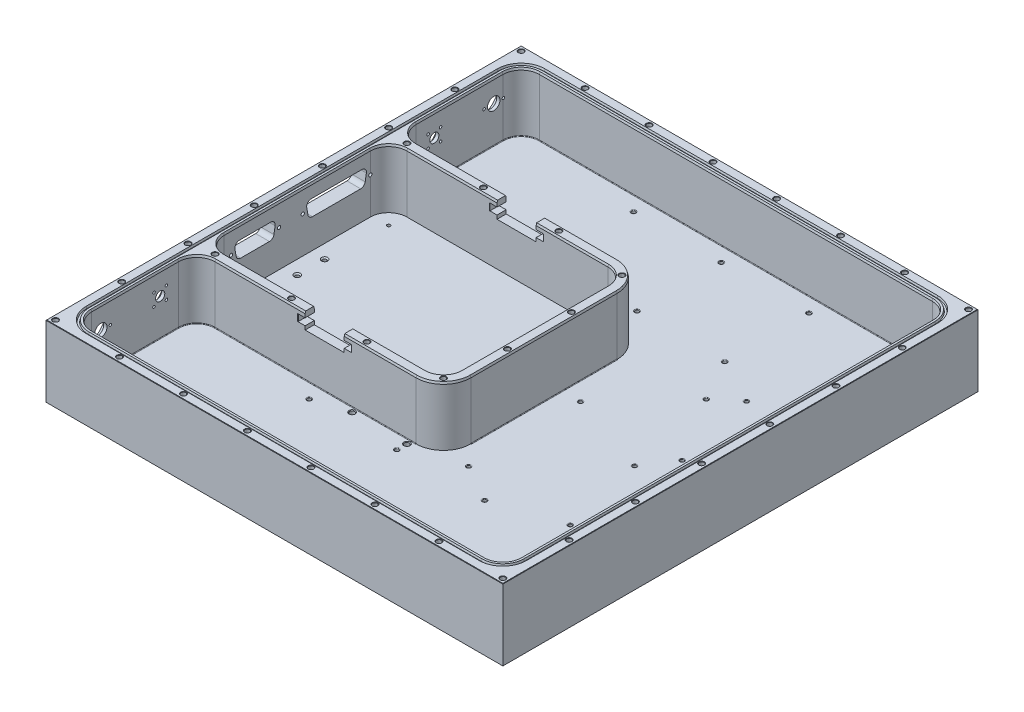
from build123d import *

# Parameters (mm, degrees)
SKETCH3_W                           = 317.5
SKETCH3_H                           = 330.2
EXTRUDE1_DEPTH                      = 8.255
SKETCH4_W                           = 317.5
SKETCH4_H                           = 330.2
EXTRUDE2_DEPTH                      = 41.275
SKETCH6_R                           = 1.7145
F_6_32_HOLES_DEPTH                  = 9.525
SKETCH16_R                          = 12.7
SMA_SMF_POCKETS_DEPTH               = 455.969838282
SKETCH17_R                          = 0.889
SKETCH17_R_2                        = 3.175
SKETCH17_R_3                        = 4.3053
MOUNT_HOLES_DEPTH                   = 12.7
SKETCH19_W                          = 27.178
SKETCH19_H                          = 175.175904301
DE9_DEPTH                           = 11.303
SKETCH18_R                          = 1.1303
DA15_DB25_DEPTH                     = 12.7
SKETCH50_R                          = 1.26365
F_4_40_OUTER_POCKET_DEPTH           = 460.936860485
SKETCH21_R                          = 1.35255
F_6_32_INSIDE_DEPTH                 = 460.936860485
FILLET1_R                           = 0.381
CUT_EXTRUDE1_REACH                  = 399.129
SKETCH31_W                          = 37.084
SKETCH31_H                          = 4.7752
FILLET2_R                           = 0.254
RADIUS_CORNERS_DEPTH                = 460.936860485
SKETCH37_R                          = 1.7145
CUT_EXTRUDE3_DEPTH                  = 9.525
SKETCH38_R                          = 1.19126
CUT_EXTRUDE5_DEPTH                  = 25.4
CHAMFER1_SIZE                       = 0.254
GROOVE_DEPTH                        = 441.184449404
GROOVE_DRAFT                        = 15
CUT_EXTRUDE7_DEPTH                  = 441.19423235
CUT_EXTRUDE7_DRAFT                  = 15
CUT_EXTRUDE7_PROFILE_2_DEPTH        = 441.19423235
CUT_EXTRUDE7_PROFILE_2_DRAFT        = 15
F_4_40_HOLE_PATTERN_INSIDE_POCKET_R = 1.1303
CUT_EXTRUDE8_DEPTH                  = 460.936860485


# Read off the part's stored shape, not the designer's step: #6-32 Tapped Hole2, #6-32 Tapped Hole3, #6-32 Tapped Hole1
with BuildPart() as part:
    # Sketch3 → Extrude1 (new body)
    with BuildSketch(Plane(origin=(0, 0, 0), x_dir=(1, 0, 0), z_dir=(0, 1, 0))):
        with Locations((158.75, 165.1)):
            Rectangle(SKETCH3_W, SKETCH3_H)
    extrude(amount=-EXTRUDE1_DEPTH)

    # Sketch4 → Extrude2 (add)
    with BuildSketch(Plane(origin=(0, 0, 0), x_dir=(1, 0, 0), z_dir=(0, 1, 0))):
        with Locations((158.75, 165.1)):
            Rectangle(SKETCH4_W, SKETCH4_H)
        with BuildLine():
            Line((9.525, 114.3), (9.525, 215.9))
            ThreePointArc((9.525, 215.9), (13.244743879, 224.880256121), (22.225, 228.6))
            Line((22.225, 228.6), (161.925, 228.6))
            ThreePointArc((161.925, 228.6), (170.905256121, 224.880256121), (174.625, 215.9))
            Line((174.625, 215.9), (174.625, 114.3))
            ThreePointArc((174.625, 114.3), (170.905256121, 105.319743879), (161.925, 101.6))
            Line((161.925, 101.6), (22.225, 101.6))
            ThreePointArc((22.225, 101.6), (13.244743879, 105.319743879), (9.525, 114.3))
        make_face(mode=Mode.SUBTRACT)
        with BuildLine():
            Line((22.225, 234.95), (180.975, 234.95))
            Line((180.975, 234.95), (180.975, 95.25))
            Line((180.975, 95.25), (22.225, 95.25))
            ThreePointArc((22.225, 95.25), (13.244743879, 91.530256121), (9.525, 82.55))
            Line((9.525, 82.55), (9.525, 22.225))
            ThreePointArc((9.525, 22.225), (13.244743879, 13.244743879), (22.225, 9.525))
            Line((22.225, 9.525), (295.275, 9.525))
            ThreePointArc((295.275, 9.525), (304.255256121, 13.244743879), (307.975, 22.225))
            Line((307.975, 22.225), (307.975, 307.975))
            ThreePointArc((307.975, 307.975), (304.255256121, 316.955256121), (295.275, 320.675))
            Line((295.275, 320.675), (22.225, 320.675))
            ThreePointArc((22.225, 320.675), (13.244743879, 316.955256121), (9.525, 307.975))
            Line((9.525, 307.975), (9.525, 247.65))
            ThreePointArc((9.525, 247.65), (13.244743879, 238.669743879), (22.225, 234.95))
        make_face(mode=Mode.SUBTRACT)
    extrude(amount=EXTRUDE2_DEPTH)

    # Sketch6 → 6-32 holes (cut)
    with BuildSketch(Plane(origin=(0, 41.275, 0), x_dir=(-1, 0, 0), z_dir=(0, 1, 0))):
        with Locations(Location((-3.302, -326.898, 0), (0, 0, 90))):
            Circle(SKETCH6_R)
        with Locations(Location((-3.302, -280.8605, 0), (0, 0, 90))):
            Circle(SKETCH6_R)
        with Locations(Location((-3.302, -234.823, 0), (0, 0, 90))):
            Circle(SKETCH6_R)
        with Locations(Location((-3.302, -188.7855, 0), (0, 0, 90))):
            Circle(SKETCH6_R)
        with Locations(Location((-3.302, -3.302, 0), (0, 0, 90))):
            Circle(SKETCH6_R)
        with Locations(Location((-3.302, -49.3395, 0), (0, 0, 90))):
            Circle(SKETCH6_R)
        with Locations(Location((-3.302, -95.377, 0), (0, 0, 90))):
            Circle(SKETCH6_R)
        with Locations(Location((-3.302, -141.4145, 0), (0, 0, 90))):
            Circle(SKETCH6_R)
        with Locations(Location((-47.752, -326.898, 0), (0, 0, 90))):
            Circle(SKETCH6_R)
        with Locations(Location((-92.202, -326.898, 0), (0, 0, 90))):
            Circle(SKETCH6_R)
        with Locations(Location((-136.652, -326.898, 0), (0, 0, 90))):
            Circle(SKETCH6_R)
        with Locations(Location((-314.198, -326.898, 0), (0, 0, 90))):
            Circle(SKETCH6_R)
        with Locations(Location((-269.748, -326.898, 0), (0, 0, 90))):
            Circle(SKETCH6_R)
        with Locations(Location((-225.298, -326.898, 0), (0, 0, 90))):
            Circle(SKETCH6_R)
        with Locations(Location((-180.848, -326.898, 0), (0, 0, 90))):
            Circle(SKETCH6_R)
        with Locations(Location((-314.198, -280.8605, 0), (0, 0, 90))):
            Circle(SKETCH6_R)
        with Locations(Location((-314.198, -234.823, 0), (0, 0, 90))):
            Circle(SKETCH6_R)
        with Locations(Location((-314.198, -188.7855, 0), (0, 0, 90))):
            Circle(SKETCH6_R)
        with Locations(Location((-47.752, -3.302, 0), (0, 0, 90))):
            Circle(SKETCH6_R)
        with Locations(Location((-92.202, -3.302, 0), (0, 0, 90))):
            Circle(SKETCH6_R)
        with Locations(Location((-136.652, -3.302, 0), (0, 0, 90))):
            Circle(SKETCH6_R)
        with Locations(Location((-314.198, -3.302, 0), (0, 0, 90))):
            Circle(SKETCH6_R)
        with Locations(Location((-269.748, -3.302, 0), (0, 0, 90))):
            Circle(SKETCH6_R)
        with Locations(Location((-225.298, -3.302, 0), (0, 0, 90))):
            Circle(SKETCH6_R)
        with Locations(Location((-180.848, -3.302, 0), (0, 0, 90))):
            Circle(SKETCH6_R)
        with Locations(Location((-314.198, -49.3395, 0), (0, 0, 90))):
            Circle(SKETCH6_R)
        with Locations(Location((-314.198, -95.377, 0), (0, 0, 90))):
            Circle(SKETCH6_R)
        with Locations(Location((-314.198, -141.4145, 0), (0, 0, 90))):
            Circle(SKETCH6_R)
        with Locations(Location((-19.05, -231.775, 0), (0, 0, 90))):
            Circle(SKETCH6_R)
        with Locations(Location((-72.2122, -231.775, 0), (0, 0, 90))):
            Circle(SKETCH6_R)
        with Locations(Location((-124.6378, -231.775, 0), (0, 0, 90))):
            Circle(SKETCH6_R)
        with Locations(Location((-177.8, -231.775, 0), (0, 0, 90))):
            Circle(SKETCH6_R)
        with Locations(Location((-177.8, -187.325, 0), (0, 0, 90))):
            Circle(SKETCH6_R)
        with Locations(Location((-177.8, -142.875, 0), (0, 0, 90))):
            Circle(SKETCH6_R)
        with Locations(Location((-177.8, -98.425, 0), (0, 0, 90))):
            Circle(SKETCH6_R)
        with Locations(Location((-124.6378, -98.425, 0), (0, 0, 90))):
            Circle(SKETCH6_R)
        with Locations(Location((-72.2122, -98.425, 0), (0, 0, 90))):
            Circle(SKETCH6_R)
        with Locations(Location((-19.05, -98.425, 0), (0, 0, 90))):
            Circle(SKETCH6_R)
    extrude(amount=-F_6_32_HOLES_DEPTH, mode=Mode.SUBTRACT)

    # Sketch16 → SMA & SMF pockets (cut, through all)
    with BuildSketch(Plane.ZY.offset(-7.239)):
        with Locations(Location((-69.85, 25.4, 0), (0, 0, 180))):
            Circle(SKETCH16_R)
        with Locations(Location((-260.35, 25.4, 0), (0, 0, 180))):
            Circle(SKETCH16_R)
        with Locations(Location((-301.625, 25.4, 0), (0, 0, 180))):
            Circle(SKETCH16_R)
        with Locations(Location((-28.575, 25.4, 0), (0, 0, 180))):
            Circle(SKETCH16_R)
    extrude(amount=SMA_SMF_POCKETS_DEPTH, mode=Mode.SUBTRACT)

    # Sketch17 → mount holes (cut)
    with BuildSketch(Plane.ZY):
        with Locations((-256.032, 21.082)):
            Circle(SKETCH17_R)
        with Locations((-256.032, 29.718)):
            Circle(SKETCH17_R)
        with Locations((-260.35, 25.4)):
            Circle(SKETCH17_R_2)
        with Locations((-264.668, 21.082)):
            Circle(SKETCH17_R)
        with Locations((-264.668, 29.718)):
            Circle(SKETCH17_R)
        with Locations((-65.532, 21.082)):
            Circle(SKETCH17_R)
        with Locations((-65.532, 29.718)):
            Circle(SKETCH17_R)
        with Locations((-74.168, 29.718)):
            Circle(SKETCH17_R)
        with Locations((-74.168, 21.082)):
            Circle(SKETCH17_R)
        with Locations((-69.85, 25.4)):
            Circle(SKETCH17_R_2)
        with Locations((-294.925, 25.4)):
            Circle(SKETCH17_R)
        with Locations((-308.325, 25.4)):
            Circle(SKETCH17_R)
        with Locations((-301.625, 25.4)):
            Circle(SKETCH17_R_3)
        with Locations((-21.875, 25.4)):
            Circle(SKETCH17_R)
        with Locations((-28.575, 25.4)):
            Circle(SKETCH17_R_3)
        with Locations((-35.275, 25.4)):
            Circle(SKETCH17_R)
    extrude(amount=-MOUNT_HOLES_DEPTH, mode=Mode.SUBTRACT)

    # Sketch19 → DE9 (cut)
    with BuildSketch(Plane(origin=(0, 41.275, 0), x_dir=(-1, 0, 0), z_dir=(0, 1, 0))):
        with Locations((-98.425, -153.785049907)):
            Rectangle(SKETCH19_W, SKETCH19_H)
    extrude(amount=-DE9_DEPTH, mode=Mode.SUBTRACT)

    # Sketch18 → DA15 & DB25 (cut)
    with BuildSketch(Plane(origin=(0, 0, 0), x_dir=(0, 0, -1), z_dir=(1, 0, 0))):
        with Locations(Location((215.9, 25.4, 0), (0, 0, 90))):
            Circle(SKETCH18_R)
        with Locations((168.91, 25.4)):
            Circle(SKETCH18_R)
        with Locations((152.4, 25.4)):
            Circle(SKETCH18_R)
        with Locations((119.1006, 25.4)):
            Circle(SKETCH18_R)
        with BuildLine():
            Line((175.653754009, 20.363332964), (209.156245991, 20.363332964))
            ThreePointArc((209.156245991, 20.363332964), (211.197096652, 21.106141857), (212.283010607, 22.987))
            Line((212.283010607, 22.987), (213.133964616, 27.813))
            ThreePointArc((213.133964616, 27.813), (212.439391107, 30.405183625), (210.0072, 31.539332964))
            Line((210.0072, 31.539332964), (174.8028, 31.539332964))
            ThreePointArc((174.8028, 31.539332964), (172.370608893, 30.405183625), (171.676035384, 27.813))
            Line((171.676035384, 27.813), (172.526989393, 22.987))
            ThreePointArc((172.526989393, 22.987), (173.612903348, 21.106141857), (175.653754009, 20.363332964))
        make_face()
        with BuildLine():
            Line((149.710164616, 27.813), (148.859210607, 22.987))
            ThreePointArc((148.859210607, 22.987), (147.773296652, 21.106141857), (145.732445991, 20.363332964))
            Line((145.732445991, 20.363332964), (125.768154009, 20.363332964))
            ThreePointArc((125.768154009, 20.363332964), (123.727303348, 21.106141857), (122.641389393, 22.987))
            Line((122.641389393, 22.987), (121.790435384, 27.813))
            ThreePointArc((121.790435384, 27.813), (122.485008893, 30.405183625), (124.9172, 31.539332964))
            Line((124.9172, 31.539332964), (146.5834, 31.539332964))
            ThreePointArc((146.5834, 31.539332964), (149.015591107, 30.405183625), (149.710164616, 27.813))
        make_face()
    extrude(amount=DA15_DB25_DEPTH, mode=Mode.SUBTRACT)

    # Sketch50 → 4-40 outer pocket (cut, through all)
    with BuildSketch(Plane(origin=(0, 0, 0), x_dir=(-1, 0, 0), z_dir=(0, 1, 0))):
        with Locations(Location((-235.839, -223.012, 0), (0, 0, 90))):
            Circle(SKETCH50_R)
        with Locations(Location((-251.079, -235.712, 0), (0, 0, 90))):
            Circle(SKETCH50_R)
        with Locations(Location((-193.675, -177.8, 0), (0, 0, 90))):
            Circle(SKETCH50_R)
        with Locations(Location((-264.287, -177.8, 0), (0, 0, 90))):
            Circle(SKETCH50_R)
        with Locations(Location((-251.079, -157.9245, 0), (0, 0, 90))):
            Circle(SKETCH50_R)
        with Locations(Location((-264.287, -100.0125, 0), (0, 0, 90))):
            Circle(SKETCH50_R)
        with Locations(Location((-193.675, -100.0125, 0), (0, 0, 90))):
            Circle(SKETCH50_R)
    extrude(amount=-F_4_40_OUTER_POCKET_DEPTH, mode=Mode.SUBTRACT)

    # Sketch21 → 6-32 inside (cut, through all)
    with BuildSketch(Plane(origin=(0, 0, 0), x_dir=(-1, 0, 0), z_dir=(0, 1, 0))):
        with Locations(Location((-97.79, -85.09, 0), (0, 0, 90))):
            Circle(SKETCH21_R)
        with Locations(Location((-158.75, -85.09, 0), (0, 0, 90))):
            Circle(SKETCH21_R)
        with Locations(Location((-219.71, -85.09, 0), (0, 0, 90))):
            Circle(SKETCH21_R)
        with Locations(Location((-97.79, -310.515, 0), (0, 0, 90))):
            Circle(SKETCH21_R)
        with Locations(Location((-97.79, -26.5176, 0), (0, 0, 90))):
            Circle(SKETCH21_R)
        with Locations(Location((-158.75, -26.5176, 0), (0, 0, 90))):
            Circle(SKETCH21_R)
        with Locations(Location((-219.71, -26.5176, 0), (0, 0, 90))):
            Circle(SKETCH21_R)
        with Locations(Location((-158.75, -310.515, 0), (0, 0, 90))):
            Circle(SKETCH21_R)
        with Locations(Location((-219.71, -310.515, 0), (0, 0, 90))):
            Circle(SKETCH21_R)
        with Locations(Location((-97.79, -251.9426, 0), (0, 0, 90))):
            Circle(SKETCH21_R)
        with Locations(Location((-158.75, -251.9426, 0), (0, 0, 90))):
            Circle(SKETCH21_R)
        with Locations(Location((-219.71, -251.9426, 0), (0, 0, 90))):
            Circle(SKETCH21_R)
    extrude(amount=-F_6_32_INSIDE_DEPTH, mode=Mode.SUBTRACT)

    # Fillet1
    fillet1_edges = [part.edges().sort_by_distance(p)[0] for p in [
        (13.244743879, 0, -238.669743879),
        (101.6, 0, -234.95),
        (180.975, 0, -165.1),
        (101.6, 0, -95.25),
        (13.244743879, 0, -91.530256121),
        (9.525, 0, -52.3875),
        (13.244743879, 0, -13.244743879),
        (158.75, 0, -9.525),
        (304.255256121, 0, -13.244743879),
        (307.975, 0, -165.1),
        (304.255256121, 0, -316.955256121),
        (158.75, 0, -320.675),
        (13.244743879, 0, -316.955256121),
        (9.525, 0, -277.8125),
        (235.839, 0, -224.27565),
        (251.079, 0, -236.97565),
        (193.675, 0, -179.06365),
        (264.287, 0, -179.06365),
        (251.079, 0, -159.18815),
        (264.287, 0, -101.27615),
        (193.675, 0, -101.27615),
        (97.79, 0, -86.44255),
        (158.75, 0, -86.44255),
        (219.71, 0, -86.44255),
        (97.79, 0, -311.86755),
        (97.79, 0, -27.87015),
        (158.75, 0, -27.87015),
        (219.71, 0, -27.87015),
        (158.75, 0, -311.86755),
        (219.71, 0, -311.86755),
        (97.79, 0, -253.29515),
        (158.75, 0, -253.29515),
        (219.71, 0, -253.29515),
    ]]
    fillet(fillet1_edges, radius=FILLET1_R)

    # Cut-Extrude1: up to this face of the body (flat: up to its plane)
    cut_extrude1_end = Plane(part.part.faces().sort_by_distance((101.757700924, 20.093113696, -234.95))[0])
    # Sketch31 → Cut-Extrude1 (cut, up to the picked face)
    with BuildSketch(Plane.XY.offset(-95.25), mode=Mode.PRIVATE) as cut_extrude1_sk1:
        with Locations((98.425, 34.925)):
            Rectangle(SKETCH31_W, SKETCH31_H)
    cut_extrude1_tool1 = split(extrude(cut_extrude1_sk1.sketch, amount=-CUT_EXTRUDE1_REACH, mode=Mode.PRIVATE), bisect_by=cut_extrude1_end, keep=Keep.BOTH, mode=Mode.PRIVATE)
    add(cut_extrude1_tool1.solids().sort_by(Axis((98.425, 34.925, -95.25), (0, 0, -1)))[0], mode=Mode.SUBTRACT)

    # Fillet2
    fillet2_edges = [part.edges().sort_by_distance(p)[0] for p in [
        (116.967, 34.925, -101.6),
        (116.967, 34.925, -228.6),
        (79.883, 34.925, -101.6),
        (79.883, 34.925, -228.6),
        (116.967, 34.925, -95.25),
        (79.883, 34.925, -95.25),
        (116.967, 34.925, -234.95),
        (79.883, 34.925, -234.95),
    ]]
    fillet(fillet2_edges, radius=FILLET2_R)

    # Sketch36 → radius corners (cut, through all)
    with BuildSketch(Plane(origin=(0, 0, 0), x_dir=(-1, 0, 0), z_dir=(0, 1, 0))):
        with BuildLine():
            Line((-180.975, -114.3), (-193.675, -114.3))
            Line((-193.675, -114.3), (-193.675, -215.9))
            Line((-193.675, -215.9), (-180.975, -215.9))
            ThreePointArc((-180.975, -215.9), (-175.395384182, -229.370384182), (-161.925, -234.95))
            Line((-161.925, -234.95), (-161.925, -253.55747471))
            Line((-161.925, -253.55747471), (-206.375, -253.55747471))
            Line((-206.375, -253.55747471), (-206.375, -76.64252529))
            Line((-206.375, -76.64252529), (-161.925, -76.64252529))
            Line((-161.925, -76.64252529), (-161.925, -95.25))
            ThreePointArc((-161.925, -95.25), (-175.395384182, -100.829615818), (-180.975, -114.3))
        make_face()
    extrude(amount=RADIUS_CORNERS_DEPTH, mode=Mode.SUBTRACT)

    # Sketch37 → Cut-Extrude3 (cut)
    with BuildSketch(Plane(origin=(0, 41.275, 0), x_dir=(-1, 0, 0), z_dir=(0, 1, 0))):
        with Locations(Location((-173.150320151, -227.125320151, 0), (0, 0, 90))):
            Circle(SKETCH37_R)
        with Locations(Location((-173.150320151, -103.074679849, 0), (0, 0, 90))):
            Circle(SKETCH37_R)
    extrude(amount=-CUT_EXTRUDE3_DEPTH, mode=Mode.SUBTRACT)

    # Sketch38 → Cut-Extrude5 (cut)
    with BuildSketch(Plane(origin=(0, 0, 0), x_dir=(0, 0, -1), z_dir=(1, 0, 0))):
        with Locations(Location((105.96626, 33.3248, 0), (0, 0, 180))):
            Circle(SKETCH38_R)
        with Locations(Location((105.96626, 19.0246, 0), (0, 0, 180))):
            Circle(SKETCH38_R)
    extrude(amount=CUT_EXTRUDE5_DEPTH, mode=Mode.SUBTRACT)

    # Chamfer1
    chamfer1_edges = [part.edges().sort_by_distance(p)[0] for p in [
        (3.302, 41.275, -51.054),
        (3.302, 41.275, -97.0915),
        (3.302, 41.275, -143.129),
        (47.752, 41.275, -328.6125),
        (92.202, 41.275, -328.6125),
        (136.652, 41.275, -328.6125),
        (314.198, 41.275, -328.6125),
        (314.198, 41.275, -5.0165),
        (269.748, 41.275, -328.6125),
        (225.298, 41.275, -328.6125),
        (180.848, 41.275, -328.6125),
        (314.198, 41.275, -282.575),
        (314.198, 41.275, -236.5375),
        (314.198, 41.275, -190.5),
        (47.752, 41.275, -5.0165),
        (92.202, 41.275, -5.0165),
        (136.652, 41.275, -5.0165),
        (269.748, 41.275, -5.0165),
        (225.298, 41.275, -5.0165),
        (180.848, 41.275, -5.0165),
        (19.05, 41.275, -233.4895),
        (314.198, 41.275, -51.054),
        (314.198, 41.275, -97.0915),
        (314.198, 41.275, -143.129),
        (72.2122, 41.275, -233.4895),
        (124.6378, 41.275, -233.4895),
        (177.8, 41.275, -189.0395),
        (177.8, 41.275, -144.5895),
        (124.6378, 41.275, -100.1395),
        (72.2122, 41.275, -100.1395),
        (19.05, 41.275, -100.1395),
        (158.75, 41.275, -330.2),
        (0, 41.275, -165.1),
        (158.75, 41.275, 0),
        (317.5, 41.275, -165.1),
        (3.302, 41.275, -328.6125),
        (173.150320151, 41.275, -228.839820151),
        (173.150320151, 41.275, -104.789179849),
        (3.302, 41.275, -282.575),
        (3.302, 41.275, -236.5375),
        (3.302, 41.275, -190.5),
        (3.302, 41.275, -5.0165),
    ]]
    chamfer(chamfer1_edges, length=CHAMFER1_SIZE)


with BuildPart() as groove_tool:
    # Sketch43 → Groove (with draft: the straight prism first)
    with BuildSketch(Plane(origin=(6.7056, 39.917500461, -22.225), x_dir=(1, 0, 0), z_dir=(0, -1, 0))):
        with BuildLine():
            Line((288.5694, 16.1544), (15.5194, 16.1544))
            ThreePointArc((15.5194, 16.1544), (4.096514214, 11.422885786), (-0.635, 0))
            Line((-0.635, 0), (-0.635, -285.75))
            ThreePointArc((-0.635, -285.75), (4.096514214, -297.172885786), (15.5194, -301.9044))
            Line((15.5194, -301.9044), (288.5694, -301.9044))
            ThreePointArc((288.5694, -301.9044), (299.992285786, -297.172885786), (304.7238, -285.75))
            Line((304.7238, -285.75), (304.7238, 0))
            ThreePointArc((304.7238, 0), (299.992285786, 11.422885786), (288.5694, 16.1544))
        make_face()
        with BuildLine():
            Line((288.5694, 14.8844), (15.5194, 14.8844))
            ThreePointArc((15.5194, 14.8844), (4.994539826, 10.524860174), (0.635, 0))
            Line((0.635, 0), (0.635, -285.75))
            ThreePointArc((0.635, -285.75), (4.994539826, -296.274860174), (15.5194, -300.6344))
            Line((15.5194, -300.6344), (288.5694, -300.6344))
            ThreePointArc((288.5694, -300.6344), (299.094260174, -296.274860174), (303.4538, -285.75))
            Line((303.4538, -285.75), (303.4538, 0))
            ThreePointArc((303.4538, 0), (299.094260174, 10.524860174), (288.5694, 14.8844))
        make_face(mode=Mode.SUBTRACT)
    extrude(amount=-GROOVE_DEPTH)
    # Groove: the draft: its side faces are tilted about the plane it starts from
    groove_sides = [groove_tool.faces().sort_by_distance(p)[0] for p in [
        (158.75, 260.509725163, -6.0706),
        (10.802114214, 260.509725163, -10.802114214),
        (6.0706, 260.509725163, -165.1),
        (10.802114214, 260.509725163, -319.397885786),
        (158.75, 260.509725163, -324.1294),
        (306.697885786, 260.509725163, -319.397885786),
        (311.4294, 260.509725163, -165.1),
        (306.697885786, 260.509725163, -10.802114214),
        (305.799860174, 260.509725163, -11.700139826),
        (310.1594, 260.509725163, -165.1),
        (305.799860174, 260.509725163, -318.499860174),
        (158.75, 260.509725163, -322.8594),
        (11.700139826, 260.509725163, -318.499860174),
        (7.3406, 260.509725163, -165.1),
        (11.700139826, 260.509725163, -11.700139826),
        (158.75, 260.509725163, -7.3406),
    ]]
    draft(groove_sides, Plane(origin=(6.7056, 39.917500461, -22.225), x_dir=(1, 0, 0), z_dir=(0, -1, 0)), GROOVE_DRAFT)


with BuildPart() as part_1:
    add(part.part)

    # Groove: cut by groove_tool
    add(groove_tool.part, mode=Mode.SUBTRACT)


with BuildPart() as cut_extrude7_tool:
    # Sketch44 → Cut-Extrude7 (with draft: the straight prism first)
    with BuildSketch(Plane(origin=(6.665983951, 39.751, -22.225), x_dir=(1, 0, 0), z_dir=(0, -1, 0))):
        with BuildLine():
            Line((2.860449714, -92.075), (2.860449714, -193.675))
            ThreePointArc((2.860449714, -193.675), (6.579773682, -202.654242367), (15.559016049, -206.373566336))
            Line((15.559016049, -206.373566336), (155.259016049, -206.373566336))
            ThreePointArc((155.259016049, -206.373566336), (164.238258417, -202.654242367), (167.957582385, -193.675))
            Line((167.957582385, -193.675), (167.957582385, -92.075))
            ThreePointArc((167.957582385, -92.075), (164.238258417, -83.095757633), (155.259016049, -79.376433664))
            Line((155.259016049, -79.376433664), (15.559016049, -79.376433664))
            ThreePointArc((15.559016049, -79.376433664), (6.579773682, -83.095757633), (2.860449714, -92.075))
        make_face()
        with BuildLine():
            Line((3.988209714, -92.075), (3.988209714, -193.675))
            ThreePointArc((3.988209714, -193.675), (7.377220426, -201.856795624), (15.559016049, -205.245806336))
            Line((15.559016049, -205.245806336), (155.259016049, -205.245806336))
            ThreePointArc((155.259016049, -205.245806336), (163.440811673, -201.856795624), (166.829822385, -193.675))
            Line((166.829822385, -193.675), (166.829822385, -92.075))
            ThreePointArc((166.829822385, -92.075), (163.440811673, -83.893204376), (155.259016049, -80.504193664))
            Line((155.259016049, -80.504193664), (15.559016049, -80.504193664))
            ThreePointArc((15.559016049, -80.504193664), (7.377220426, -83.893204376), (3.988209714, -92.075))
        make_face(mode=Mode.SUBTRACT)
    extrude(amount=-CUT_EXTRUDE7_DEPTH)
    # Cut-Extrude7: the draft: its side faces are tilted about the plane it starts from
    cut_extrude7_sides = [cut_extrude7_tool.faces().sort_by_distance(p)[0] for p in [
        (9.526433664, 260.348116175, -165.1),
        (13.245757633, 260.348116175, -224.879242367),
        (92.075, 260.348116175, -228.598566336),
        (170.904242367, 260.348116175, -224.879242367),
        (174.623566336, 260.348116175, -165.1),
        (170.904242367, 260.348116175, -105.320757633),
        (92.075, 260.348116175, -101.601433664),
        (13.245757633, 260.348116175, -105.320757633),
        (14.043204376, 260.348116175, -106.118204376),
        (92.075, 260.348116175, -102.729193664),
        (170.106795624, 260.348116175, -106.118204376),
        (173.495806336, 260.348116175, -165.1),
        (170.106795624, 260.348116175, -224.081795624),
        (92.075, 260.348116175, -227.470806336),
        (14.043204376, 260.348116175, -224.081795624),
        (10.654193664, 260.348116175, -165.1),
    ]]
    draft(cut_extrude7_sides, Plane(origin=(6.665983951, 39.751, -22.225), x_dir=(1, 0, 0), z_dir=(0, -1, 0)), CUT_EXTRUDE7_DRAFT)


with BuildPart() as part_2:
    add(part_1.part)

    # Cut-Extrude7: cut by cut_extrude7_tool
    add(cut_extrude7_tool.part, mode=Mode.SUBTRACT)


with BuildPart() as cut_extrude7_profile_2_tool:
    # Sketch44 → Cut-Extrude7 profile 2 (with draft: the straight prism first)
    with BuildSketch(Plane(origin=(6.665983951, 39.751, -22.225), x_dir=(1, 0, 0), z_dir=(0, -1, 0))):
        with BuildLine():
            Line((2.860449714, -225.425), (2.860449714, -285.75))
            ThreePointArc((2.860449714, -285.75), (6.579773682, -294.729242367), (15.559016049, -298.448566336))
            Line((15.559016049, -298.448566336), (288.609016049, -298.448566336))
            ThreePointArc((288.609016049, -298.448566336), (297.588258417, -294.729242367), (301.307582385, -285.75))
            Line((301.307582385, -285.75), (301.307582385, 0))
            ThreePointArc((301.307582385, 0), (297.588258417, 8.979242367), (288.609016049, 12.698566336))
            Line((288.609016049, 12.698566336), (15.559016049, 12.698566336))
            ThreePointArc((15.559016049, 12.698566336), (6.579773682, 8.979242367), (2.860449714, 0))
            Line((2.860449714, 0), (2.860449714, -60.325))
            ThreePointArc((2.860449714, -60.325), (6.579773682, -69.304242367), (15.559016049, -73.023566336))
            Line((15.559016049, -73.023566336), (155.259016049, -73.023566336))
            ThreePointArc((155.259016049, -73.023566336), (168.730413985, -78.603602065), (174.310449714, -92.075))
            Line((174.310449714, -92.075), (174.310449714, -193.675))
            ThreePointArc((174.310449714, -193.675), (168.730413985, -207.146397935), (155.259016049, -212.726433664))
            Line((155.259016049, -212.726433664), (15.559016049, -212.726433664))
            ThreePointArc((15.559016049, -212.726433664), (6.579773682, -216.445757633), (2.860449714, -225.425))
        make_face()
        with BuildLine():
            Line((3.988209714, -225.425), (3.988209714, -285.75))
            ThreePointArc((3.988209714, -285.75), (7.377220426, -293.931795624), (15.559016049, -297.320806336))
            Line((15.559016049, -297.320806336), (288.609016049, -297.320806336))
            ThreePointArc((288.609016049, -297.320806336), (296.790811673, -293.931795624), (300.179822385, -285.75))
            Line((300.179822385, -285.75), (300.179822385, 0))
            ThreePointArc((300.179822385, 0), (296.790811673, 8.181795624), (288.609016049, 11.570806336))
            Line((288.609016049, 11.570806336), (15.559016049, 11.570806336))
            ThreePointArc((15.559016049, 11.570806336), (7.377220426, 8.181795624), (3.988209714, 0))
            Line((3.988209714, 0), (3.988209714, -60.325))
            ThreePointArc((3.988209714, -60.325), (7.377220426, -68.506795624), (15.559016049, -71.895806336))
            Line((15.559016049, -71.895806336), (155.259016049, -71.895806336))
            ThreePointArc((155.259016049, -71.895806336), (169.527860728, -77.806155321), (175.438209714, -92.075))
            Line((175.438209714, -92.075), (175.438209714, -193.675))
            ThreePointArc((175.438209714, -193.675), (169.527860728, -207.943844679), (155.259016049, -213.854193664))
            Line((155.259016049, -213.854193664), (15.559016049, -213.854193664))
            ThreePointArc((15.559016049, -213.854193664), (7.377220426, -217.243204376), (3.988209714, -225.425))
        make_face(mode=Mode.SUBTRACT)
    extrude(amount=-CUT_EXTRUDE7_PROFILE_2_DEPTH)
    # Cut-Extrude7 profile 2: the draft: its side faces are tilted about the plane it starts from
    cut_extrude7_profile_2_sides = [cut_extrude7_profile_2_tool.faces().sort_by_distance(p)[0] for p in [
        (92.075, 260.348116175, -95.248566336),
        (175.396397935, 260.348116175, -100.828602065),
        (180.976433664, 260.348116175, -165.1),
        (175.396397935, 260.348116175, -229.371397935),
        (92.075, 260.348116175, -234.951433664),
        (13.245757633, 260.348116175, -238.670757633),
        (9.526433664, 260.348116175, -277.8125),
        (13.245757633, 260.348116175, -316.954242367),
        (158.75, 260.348116175, -320.673566336),
        (304.254242367, 260.348116175, -316.954242367),
        (307.973566336, 260.348116175, -165.1),
        (304.254242367, 260.348116175, -13.245757633),
        (158.75, 260.348116175, -9.526433664),
        (13.245757633, 260.348116175, -13.245757633),
        (9.526433664, 260.348116175, -52.3875),
        (13.245757633, 260.348116175, -91.529242367),
        (92.075, 260.348116175, -94.120806336),
        (14.043204376, 260.348116175, -90.731795624),
        (10.654193664, 260.348116175, -52.3875),
        (14.043204376, 260.348116175, -14.043204376),
        (158.75, 260.348116175, -10.654193664),
        (303.456795624, 260.348116175, -14.043204376),
        (306.845806336, 260.348116175, -165.1),
        (303.456795624, 260.348116175, -316.156795624),
        (158.75, 260.348116175, -319.545806336),
        (14.043204376, 260.348116175, -316.156795624),
        (10.654193664, 260.348116175, -277.8125),
        (14.043204376, 260.348116175, -239.468204376),
        (92.075, 260.348116175, -236.079193664),
        (176.193844679, 260.348116175, -230.168844679),
        (182.104193664, 260.348116175, -165.1),
        (176.193844679, 260.348116175, -100.031155321),
    ]]
    draft(cut_extrude7_profile_2_sides, Plane(origin=(6.665983951, 39.751, -22.225), x_dir=(1, 0, 0), z_dir=(0, -1, 0)), CUT_EXTRUDE7_PROFILE_2_DRAFT)


with BuildPart() as part_3:
    add(part_2.part)

    # Cut-Extrude7 profile 2: cut by cut_extrude7_profile_2_tool
    add(cut_extrude7_profile_2_tool.part, mode=Mode.SUBTRACT)

    # #6-32 Tapped Hole2 outline → #6-32 Tapped Hole2 (revolve, cut)
    with BuildSketch(Plane(origin=(120.65, 0, -92.075), x_dir=(1, 0, 0), z_dir=(0, 0, 1))):
        Polygon((2.159, 0), (0, 0), (0, -8.255), (2.159, -8.255), (1.7526, -7.8486), (1.7526, -0.4064), align=None)
    revolve(axis=Axis((120.65, 0, -92.075), (0, 1, 0)), mode=Mode.SUBTRACT)

    # 6-32 Tapped Hole2 2 outline → 6-32 Tapped Hole2 2 (revolve, cut)
    with BuildSketch(Plane(origin=(158.75, 0, -92.075), x_dir=(1, 0, 0), z_dir=(0, 0, 1))):
        Polygon((2.159, 0), (0, 0), (0, -8.255), (2.159, -8.255), (1.7526, -7.8486), (1.7526, -0.4064), align=None)
    revolve(axis=Axis((158.75, 0, -92.075), (0, 1, 0)), mode=Mode.SUBTRACT)

    # 6-32 Tapped Hole2 3 outline → 6-32 Tapped Hole2 3 (revolve, cut)
    with BuildSketch(Plane(origin=(158.75, 0, -238.125), x_dir=(1, 0, 0), z_dir=(0, 0, 1))):
        Polygon((2.159, 0), (0, 0), (0, -8.255), (2.159, -8.255), (1.7526, -7.8486), (1.7526, -0.4064), align=None)
    revolve(axis=Axis((158.75, 0, -238.125), (0, 1, 0)), mode=Mode.SUBTRACT)

    # 6-32 Tapped Hole2 4 outline → 6-32 Tapped Hole2 4 (revolve, cut)
    with BuildSketch(Plane(origin=(120.65, 0, -238.125), x_dir=(1, 0, 0), z_dir=(0, 0, 1))):
        Polygon((2.159, 0), (0, 0), (0, -8.255), (2.159, -8.255), (1.7526, -7.8486), (1.7526, -0.4064), align=None)
    revolve(axis=Axis((120.65, 0, -238.125), (0, 1, 0)), mode=Mode.SUBTRACT)

    # #6-32 Tapped Hole3 outline → #6-32 Tapped Hole3 (revolve, cut)
    with BuildSketch(Plane(origin=(19.05, 0, -174.625), x_dir=(1, 0, 0), z_dir=(0, 0, 1))):
        Polygon((0, -8.255), (2.159, -8.255), (1.35255, -7.44855), (1.35255, -0.80645), (2.159, 0), (0, 0), align=None)
    revolve(axis=Axis((19.05, 0, -174.625), (0, 1, 0)), mode=Mode.SUBTRACT)

    # 6-32 Tapped Hole3 2 outline → 6-32 Tapped Hole3 2 (revolve, cut)
    with BuildSketch(Plane(origin=(19.05, 0, -155.575), x_dir=(1, 0, 0), z_dir=(0, 0, 1))):
        Polygon((0, -8.255), (2.159, -8.255), (1.35255, -7.44855), (1.35255, -0.80645), (2.159, 0), (0, 0), align=None)
    revolve(axis=Axis((19.05, 0, -155.575), (0, 1, 0)), mode=Mode.SUBTRACT)

    # #6-32 Tapped Hole1 outline → #6-32 Tapped Hole1 (revolve, cut)
    with BuildSketch(Plane(origin=(139.7, 0, -165.1), x_dir=(1, 0, 0), z_dir=(0, 0, 1))):
        Polygon((2.159, 0), (0, 0), (0, -8.255), (2.159, -8.255), (1.7526, -7.8486), (1.7526, -0.4064), align=None)
    revolve(axis=Axis((139.7, 0, -165.1), (0, 1, 0)), mode=Mode.SUBTRACT)

    # 4-40 hole pattern inside pocket → Cut-Extrude8 (cut, through all)
    with BuildSketch(Plane(origin=(0, 0, 0), x_dir=(-1, 0, 0), z_dir=(0, 1, 0))):
        with Locations(Location((-20.955, -113.03, 0), (0, 0, 90))):
            Circle(F_4_40_HOLE_PATTERN_INSIDE_POCKET_R)
        with Locations(Location((-20.955, -217.17, 0), (0, 0, 90))):
            Circle(F_4_40_HOLE_PATTERN_INSIDE_POCKET_R)
        with Locations(Location((-163.195, -217.17, 0), (0, 0, 90))):
            Circle(F_4_40_HOLE_PATTERN_INSIDE_POCKET_R)
        with Locations(Location((-163.195, -113.03, 0), (0, 0, 90))):
            Circle(F_4_40_HOLE_PATTERN_INSIDE_POCKET_R)
    extrude(amount=-CUT_EXTRUDE8_DEPTH, mode=Mode.SUBTRACT)


solid = part_3.part
